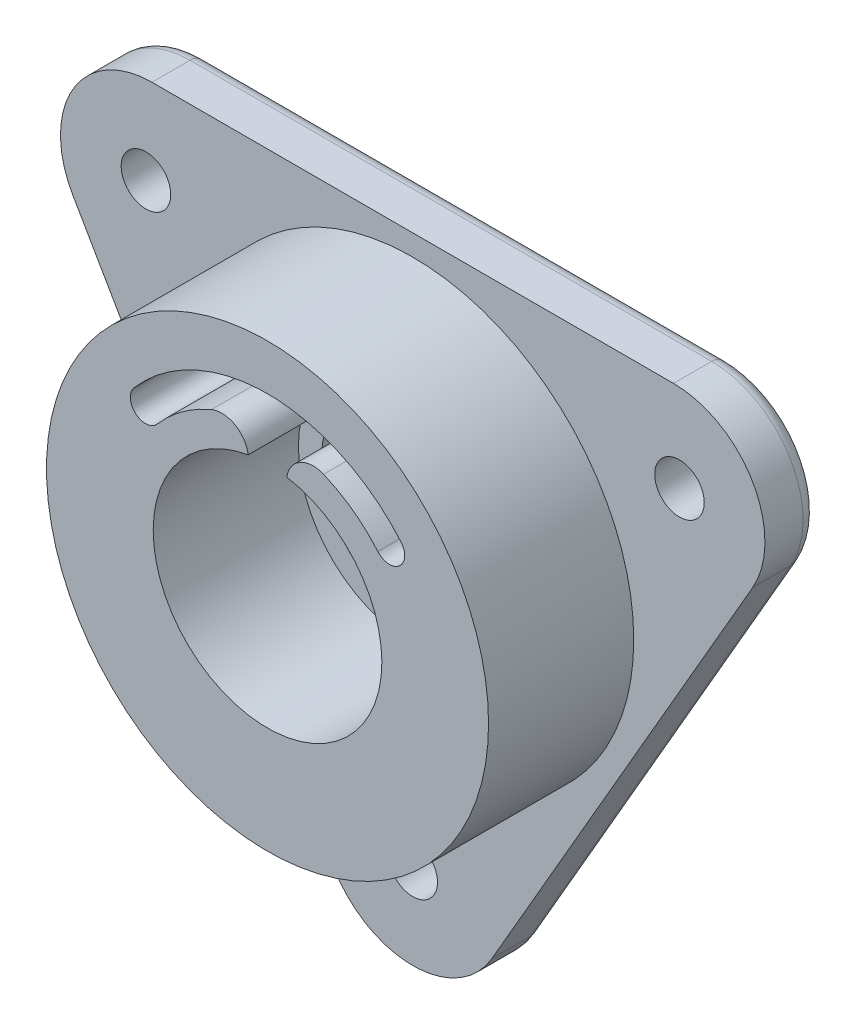
from build123d import *

# Parameters (mm, degrees)
ESQUISSE3_R             = 1.6250000000000002
ESQUISSE3_R_2           = 1.6250000000000007
ESQUISSE3_R_3           = 1.625000000000001
ESQUISSE3_R_4           = 6
BOSS_EXTRU_1_DEPTH      = 3.5
ESQUISSE4_R             = 14.499999999999998
ESQUISSE4_R_2           = 7.5
BOSS_EXTRU_2_DEPTH      = 9.524999999999999
CONG_2_R                = 1
CONG_3_R                = 6
ENL_V_MAT_EXTRU_1_DEPTH = 37.971588497459535
ENL_V_MAT_EXTRU_2_DEPTH = 37.971588497459535


with BuildPart() as part:
    # Esquisse3 → Boss.-Extru.1 (new body)
    with BuildSketch(Plane.XY):
        Polygon((0, -31.754264805429408), (-27.499999999999993, 15.877132402714718), (27.500000000000007, 15.877132402714718), align=None)
        with Locations((-17.5, 10.103629710818455)):
            Circle(ESQUISSE3_R, mode=Mode.SUBTRACT)
        with Locations((17.500000000000007, 10.10362971081846)):
            Circle(ESQUISSE3_R_2, mode=Mode.SUBTRACT)
        with Locations((4.24e-15, -20.2072594216369)):
            Circle(ESQUISSE3_R_3, mode=Mode.SUBTRACT)
        Circle(ESQUISSE3_R_4, mode=Mode.SUBTRACT)
    extrude(amount=BOSS_EXTRU_1_DEPTH)

    # Esquisse4 → Boss.-Extru.2 (add)
    with BuildSketch(Plane.XY.offset(3.5)):
        Circle(ESQUISSE4_R)
        Circle(ESQUISSE4_R_2, mode=Mode.SUBTRACT)
    extrude(amount=BOSS_EXTRU_2_DEPTH)

    # Congé2
    cong_2_edges = [part.edges().sort_by_distance(p)[0] for p in [
        (-13.749999999999996, -7.938566201357347, 0),
        (7.11e-15, 15.877132402714718, 0),
        (13.750000000000004, -7.938566201357343, 0),
    ]]
    fillet(cong_2_edges, radius=CONG_2_R)

    # Congé3
    # the kernel refuses this fillet: 6 mm, written as the material it takes off along each edge
    with BuildSketch(Plane(origin=(8.9e-16, -19.754264805429408, 0), x_dir=(0.8660254037844386, -0.5000000000000001, 0), z_dir=(0.5000000000000001, 0.8660254037844386, 0))) as cong_3_piece_1:
        with BuildLine():
            CenterArc((5, -1), 1, 0, 90)
            Line((6, -1), (6, 0))
            Line((6, 0), (5, 0))
        make_face()
    revolve(axis=Axis((8.9e-16, -19.754264805429408, 0), (0, 0, -1)), revolution_arc=120.00000000000001, mode=Mode.SUBTRACT)
    with BuildSketch(Plane(origin=(17.10769515458674, 9.877132402714714, 0), x_dir=(0, 1, 0), z_dir=(-1, 0, 0))) as cong_3_piece_2:
        with BuildLine():
            CenterArc((5, -1), 1, 0, 90)
            Line((6, -1), (6, 0))
            Line((6, 0), (5, 0))
        make_face()
    revolve(axis=Axis((17.10769515458674, 9.877132402714714, 0), (0, 0, -1)), revolution_arc=120.00000000000001, mode=Mode.SUBTRACT)
    with BuildSketch(Plane(origin=(-17.107695154586732, 9.877132402714722, 0), x_dir=(-0.8660254037844387, -0.49999999999999994, 0), z_dir=(0.49999999999999994, -0.8660254037844387, 0))) as cong_3_piece_3:
        with BuildLine():
            CenterArc((5, -1), 1, 0, 90)
            Line((6, -1), (6, 0))
            Line((6, 0), (5, 0))
        make_face()
    revolve(axis=Axis((-17.107695154586732, 9.877132402714722, 0), (0, 0, -1)), revolution_arc=119.99999999999999, mode=Mode.SUBTRACT)
    with BuildSketch(Plane(origin=(-6.7e-16, -31.754264805429408, -2.2e-16), x_dir=(-0.4999999999999999, 0.8660254037844388, 0), z_dir=(0, 0, 1))) as cong_3_piece_4:
        with BuildLine():
            CenterArc((CONG_3_R * 1.73205080757, -CONG_3_R), CONG_3_R, 90.00000000000003, 119.99999999999994)
            Line((CONG_3_R * 0.866025403784, -CONG_3_R * 1.5), (0, 0))
            Line((0, 0), (CONG_3_R * 1.73205080757, 1.1e-16))
        make_face()
    extrude(amount=29.48076211353316, mode=Mode.SUBTRACT)
    with BuildSketch(Plane(origin=(-27.499999999999996, 15.877132402714722, -2.2e-16), x_dir=(0.5, -0.8660254037844386, 0), z_dir=(0, 0, 1))) as cong_3_piece_5:
        with BuildLine():
            CenterArc((CONG_3_R * 1.73205080757, CONG_3_R), CONG_3_R, 150.00000000000003, 119.99999999999997)
            Line((CONG_3_R * 0.866025403784, CONG_3_R * 1.5), (0, 0))
            Line((0, 0), (CONG_3_R * 1.73205080757, 0))
        make_face()
    extrude(amount=29.480762113533153, mode=Mode.SUBTRACT)
    with BuildSketch(Plane(origin=(27.500000000000007, 15.877132402714718, -2.2e-16), x_dir=(-0.5000000000000001, -0.8660254037844385, 0), z_dir=(0, 0, 1))) as cong_3_piece_6:
        with BuildLine():
            CenterArc((CONG_3_R * 1.73205080757, -CONG_3_R), CONG_3_R, 90.00000000000003, 119.99999999999994)
            Line((CONG_3_R * 0.866025403784, -CONG_3_R * 1.5), (0, 0))
            Line((0, 0), (CONG_3_R * 1.73205080757, 1.1e-16))
        make_face()
    extrude(amount=29.480762113533174, mode=Mode.SUBTRACT)

    # Esquisse5 → Enlèv. mat.-Extru.1 (cut, through all)
    with BuildSketch(Plane.XY.offset(13.024999999999999)):
        with BuildLine():
            ThreePointArc((-7.238095238095237, 6.153046182523176), (5.8e-16, 9.499999999999998), (7.238095238095237, 6.153046182523176))
            ThreePointArc((7.238095238095237, 6.153046182523176), (8.647689071844546, 6.038830492462959), (8.761904761904761, 7.448424326212267))
            ThreePointArc((8.761904761904761, 7.448424326212267), (7e-16, 11.5), (-8.761904761904761, 7.448424326212267))
            ThreePointArc((-8.761904761904761, 7.448424326212267), (-8.647689071844544, 6.038830492462961), (-7.238095238095237, 6.153046182523176))
        make_face()
    extrude(amount=-ENL_V_MAT_EXTRU_1_DEPTH, mode=Mode.SUBTRACT)

    # Esquisse6 → Enlèv. mat.-Extru.2 (cut, through all)
    with BuildSketch(Plane.XY.offset(13.024999999999999)):
        with BuildLine():
            ThreePointArc((-2.322580645161291, 5.532234552757338), (-1.3864315887791117, 7.823222318816936), (-3.677419354838709, 8.759371375199114))
            ThreePointArc((-3.677419354838709, 8.759371375199114), (5.8e-16, 9.499999999999998), (3.677419354838709, 8.759371375199114))
            ThreePointArc((3.677419354838709, 8.759371375199114), (1.3864315887791128, 7.823222318816936), (2.322580645161291, 5.532234552757338))
            ThreePointArc((2.322580645161291, 5.532234552757338), (3.7e-16, 6.000000000000003), (-2.322580645161291, 5.532234552757338))
        make_face()
    extrude(amount=-ENL_V_MAT_EXTRU_2_DEPTH, mode=Mode.SUBTRACT)


solid = part.part
